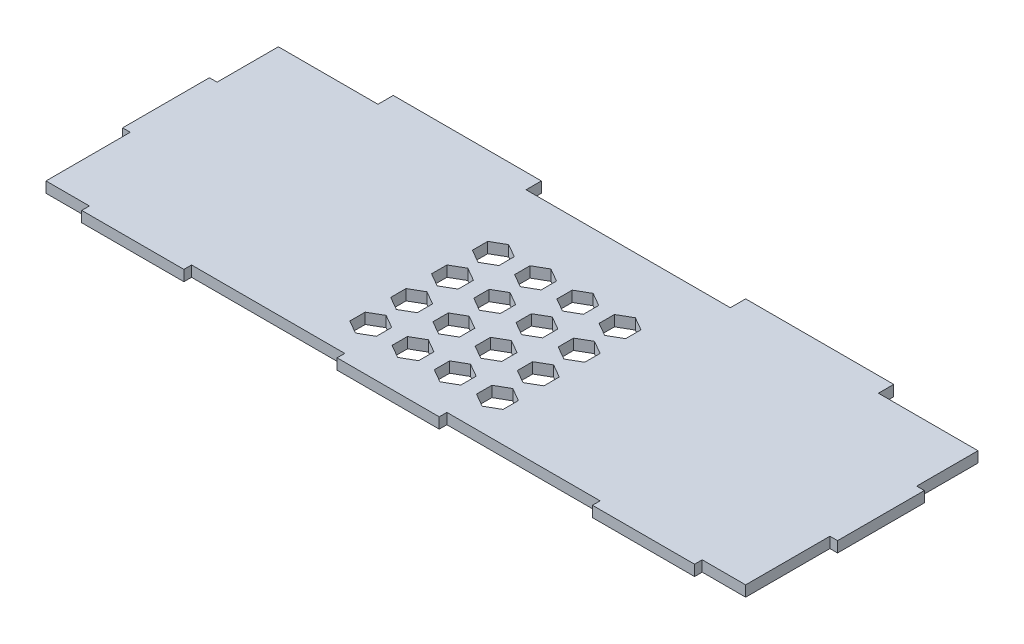
from build123d import *

# Parameters (mm, degrees)
BOSS_EXTRUDE1_DEPTH = 2.1
CUT_EXTRUDE1_DEPTH  = 75.87763351
SKETCH6_W           = 1.5
SKETCH6_H           = 12
SKETCH6_W_2         = 30
SKETCH6_H_2         = 1.5
CUT_EXTRUDE2_DEPTH  = 75.87763351


with BuildPart() as part:
    # Sketch2 → Boss-Extrude1 (new body)
    with BuildSketch(Plane(origin=(0, 0, 0), x_dir=(1, 0, 0), z_dir=(0, 1, 0))):
        Polygon((-70, 23.5), (-49, 23.5), (-49, 26.5), (-20, 26.5), (-20, 23.5), (20, 23.5), (20, 26.5), (49, 26.5), (49, 23.5), (70, 23.5), (70, -23.5), (-70, -23.5), align=None)
    extrude(amount=BOSS_EXTRUDE1_DEPTH)

    # Sketch5 → Cut-Extrude1 (cut, through all)
    with BuildSketch(Plane(origin=(0, 2.1, 0), x_dir=(1, 0, 0), z_dir=(0, 1, 0))):
        Polygon((-4.133974596, -11.5), (-6.732050808, -13), (-6.732050808, -16), (-4.133974596, -17.5), (-1.535898385, -16), (-1.535898385, -13), align=None)
        Polygon((-12.401923789, -11.5), (-15, -13), (-15, -16), (-12.401923789, -17.5), (-9.803847577, -16), (-9.803847577, -13), align=None)
        Polygon((4.133974596, -11.5), (1.535898385, -13), (1.535898385, -16), (4.133974596, -17.5), (6.732050808, -16), (6.732050808, -13), align=None)
        Polygon((12.401923789, -11.5), (9.803847577, -13), (9.803847577, -16), (12.401923789, -17.5), (15, -16), (15, -13), align=None)
        Polygon((-4.133974596, -3.5), (-6.732050808, -5), (-6.732050808, -8), (-4.133974596, -9.5), (-1.535898385, -8), (-1.535898385, -5), align=None)
        Polygon((4.133974596, -3.5), (1.535898385, -5), (1.535898385, -8), (4.133974596, -9.5), (6.732050808, -8), (6.732050808, -5), align=None)
        Polygon((12.401923789, -3.5), (9.803847577, -5), (9.803847577, -8), (12.401923789, -9.5), (15, -8), (15, -5), align=None)
        Polygon((-4.133974596, 4.5), (-6.732050808, 3), (-6.732050808, 0), (-4.133974596, -1.5), (-1.535898385, 0), (-1.535898385, 3), align=None)
        Polygon((4.133974596, 4.5), (1.535898385, 3), (1.535898385, 0), (4.133974596, -1.5), (6.732050808, 0), (6.732050808, 3), align=None)
        Polygon((12.401923789, 4.5), (9.803847577, 3), (9.803847577, 0), (12.401923789, -1.5), (15, 0), (15, 3), align=None)
        Polygon((-4.133974596, 12.5), (-6.732050808, 11), (-6.732050808, 8), (-4.133974596, 6.5), (-1.535898385, 8), (-1.535898385, 11), align=None)
        Polygon((4.133974596, 12.5), (1.535898385, 11), (1.535898385, 8), (4.133974596, 6.5), (6.732050808, 8), (6.732050808, 11), align=None)
        Polygon((12.401923789, 12.5), (9.803847577, 11), (9.803847577, 8), (12.401923789, 6.5), (15, 8), (15, 11), align=None)
        Polygon((-12.401923789, -3.5), (-15, -5), (-15, -8), (-12.401923789, -9.5), (-9.803847577, -8), (-9.803847577, -5), align=None)
        Polygon((-12.401923789, 4.5), (-15, 3), (-15, 0), (-12.401923789, -1.5), (-9.803847577, 0), (-9.803847577, 3), align=None)
        Polygon((-12.401923789, 12.5), (-15, 11), (-15, 8), (-12.401923789, 6.5), (-9.803847577, 8), (-9.803847577, 11), align=None)
    extrude(amount=-CUT_EXTRUDE1_DEPTH, mode=Mode.SUBTRACT)

    # Sketch6 → Cut-Extrude2 (cut, through all)
    with BuildSketch(Plane(origin=(0, 2.1, 0), x_dir=(1, 0, 0), z_dir=(0, 1, 0))):
        with Locations((69.25, 17.5)):
            Rectangle(SKETCH6_W, SKETCH6_H)
        Polygon((70, -5.5), (68.5, -5.5), (68.5, -22), (60, -22), (60, -23.5), (70, -23.5), align=None)
        with Locations((25, -22.75)):
            Rectangle(SKETCH6_W_2, SKETCH6_H_2)
        with Locations((-25, -22.75)):
            Rectangle(SKETCH6_W_2, SKETCH6_H_2)
        with Locations((-69.25, 17.5)):
            Rectangle(SKETCH6_W, SKETCH6_H)
        Polygon((-68.5, -5.5), (-70, -5.5), (-70, -23.5), (-60, -23.5), (-60, -22), (-68.5, -22), align=None)
    extrude(amount=-CUT_EXTRUDE2_DEPTH, mode=Mode.SUBTRACT)


solid = part.part
